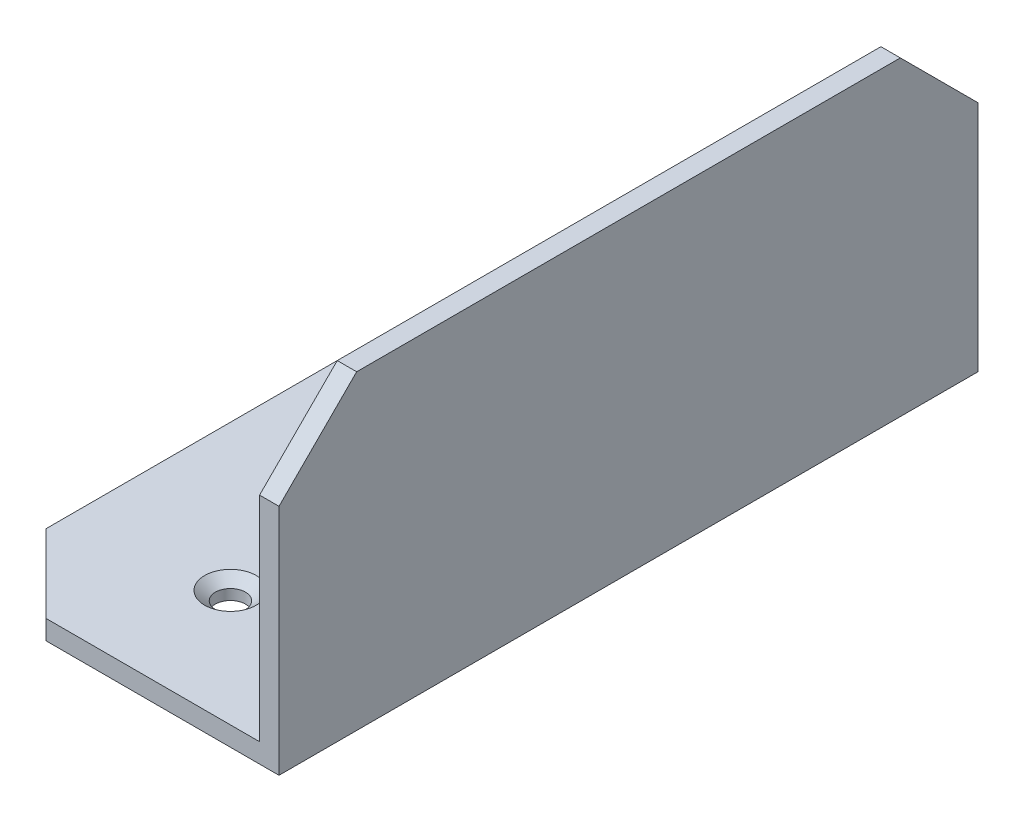
from build123d import *

# Parameters (mm, degrees)
BOSS_EXTRUDE1_DEPTH                       = 114.3
CHAMFER1_SIZE                             = 12.7
CSK_FOR_8_FLAT_HEAD_MACHINE_SCREW_2_COUNT = 2
CSK_FOR_8_FLAT_HEAD_MACHINE_SCREW_2_PITCH = 76.2
CSK_FOR_8_FLAT_HEAD_MACHINE_SCREW_3_COUNT = 2
CSK_FOR_8_FLAT_HEAD_MACHINE_SCREW_3_PITCH = 38.1
CSK_FOR_8_FLAT_HEAD_MACHINE_SCREW_4_COUNT = 2
CSK_FOR_8_FLAT_HEAD_MACHINE_SCREW_4_PITCH = 44.45


with BuildPart() as part:
    # Sketch2 → Boss-Extrude1 (new body)
    with BuildSketch(Plane.XY):
        Polygon((0, 0), (0, 50.8), (-3.175, 50.8), (-3.175, 3.175), (-50.8, 3.175), (-50.8, 0), align=None)
    extrude(amount=-BOSS_EXTRUDE1_DEPTH)

    # Chamfer1
    chamfer1_edges = [part.edges().sort_by_distance(p)[0] for p in [
        (-50.8, 1.5875, -114.3),
        (-1.5875, 50.8, -114.3),
        (-1.5875, 50.8, 0),
        (-50.8, 1.5875, 0),
    ]]
    chamfer(chamfer1_edges, length=CHAMFER1_SIZE)

    # Sketch4 → CSK for #8 Flat Head Machine Screw (100)1 (revolve, cut)
    with BuildSketch(Plane(origin=(-26.9875, 3.175, -95.25), x_dir=(0, 0, 1), z_dir=(1, 0, 0))):
        Polygon((0, 0), (0, 3.175), (2.45745, 3.175), (2.45745, 1.475934296), (4.2164, 0), align=None)
    csk_for_8_flat_head_machine_screw_100 = revolve(axis=Axis((-26.9875, 9.525, -95.25), (0, -1, 0)), mode=Mode.SUBTRACT)

    # CSK for _8 Flat Head Machine Screw _ 2: CSK for #8 Flat Head Machine Screw (100)1 ×2
    with Locations(*[(0, 0, i * CSK_FOR_8_FLAT_HEAD_MACHINE_SCREW_2_PITCH) for i in range(1, CSK_FOR_8_FLAT_HEAD_MACHINE_SCREW_2_COUNT)]):
        add(csk_for_8_flat_head_machine_screw_100, mode=Mode.SUBTRACT)

    # CSK for _8 Flat Head Machine Screw _ 3: CSK for #8 Flat Head Machine Screw (100)1 ×2
    with Locations(*[(0, 0, i * CSK_FOR_8_FLAT_HEAD_MACHINE_SCREW_3_PITCH) for i in range(1, CSK_FOR_8_FLAT_HEAD_MACHINE_SCREW_3_COUNT)]):
        add(csk_for_8_flat_head_machine_screw_100, mode=Mode.SUBTRACT)

    # CSK for _8 Flat Head Machine Screw _ 4: CSK for #8 Flat Head Machine Screw (100)1 ×2
    with Locations(*[(0, 0, -i * CSK_FOR_8_FLAT_HEAD_MACHINE_SCREW_4_PITCH) for i in range(1, CSK_FOR_8_FLAT_HEAD_MACHINE_SCREW_4_COUNT)]):
        add(csk_for_8_flat_head_machine_screw_100, mode=Mode.SUBTRACT)


solid = part.part
